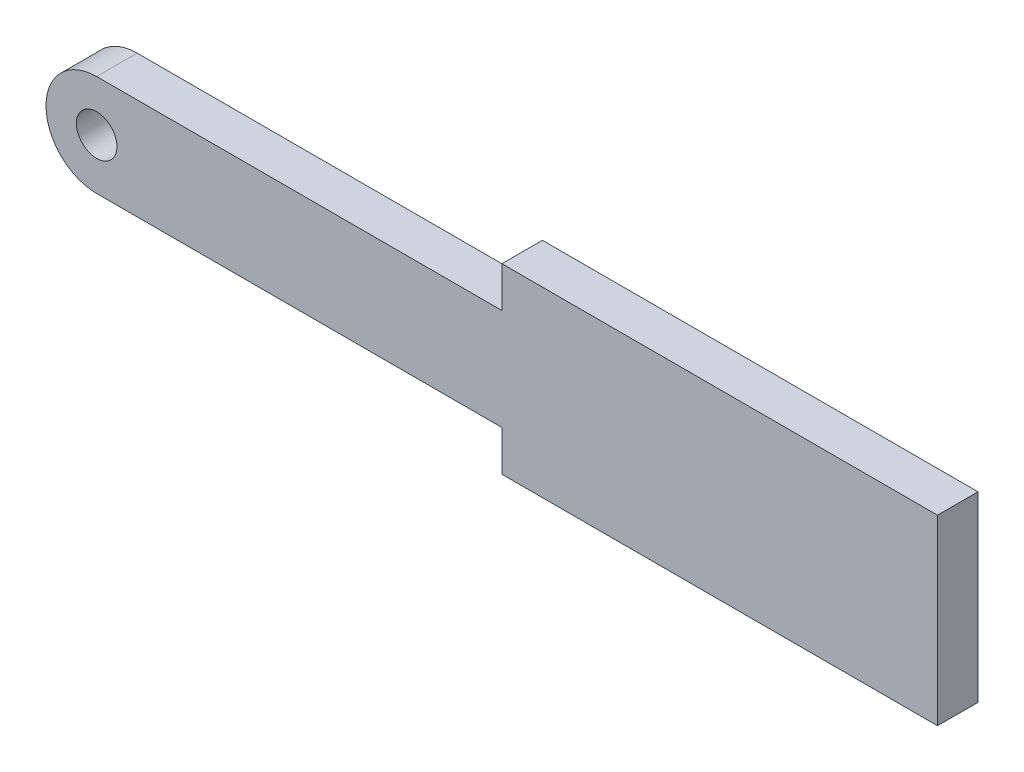
from build123d import *

# Parameters (mm, degrees)
SKETCH1_W           = 43
SKETCH1_H           = 18
BOSS_EXTRUDE1_DEPTH = 4
CAVITY2_DEPTH       = 2.3
BOSS_EXTRUDE2_DEPTH = 4


# Read off the part's stored shape, not the designer's step: Cavity2
with BuildPart() as part:
    # Sketch1 → Boss-Extrude1 (new body)
    with BuildSketch(Plane.XY):
        Rectangle(SKETCH1_W, SKETCH1_H)
    extrude(amount=BOSS_EXTRUDE1_DEPTH)

    # Cavity2 outline → Cavity2 (cut)
    with BuildSketch(Plane.XY):
        with BuildLine():
            ThreePointArc((-4.514897629, -4.536044466), (0, -6.4), (4.514897629, -4.536044466))
            Line((4.514897629, -4.536044466), (17, -2.7))
            ThreePointArc((17, -2.7), (19.7, 0), (17, 2.7))
            Line((17, 2.7), (4.514897629, 4.536044466))
            ThreePointArc((4.514897629, 4.536044466), (0, 6.4), (-4.514897629, 4.536044466))
            Line((-4.514897629, 4.536044466), (-17, 2.7))
            ThreePointArc((-17, 2.7), (-19.7, 0), (-17, -2.7))
            Line((-17, -2.7), (-4.514897629, -4.536044466))
        make_face()
    extrude(amount=CAVITY2_DEPTH, mode=Mode.SUBTRACT)

    # Sketch4 → Boss-Extrude2 (add)
    with BuildSketch(Plane.XY.offset(4)):
        with BuildLine():
            ThreePointArc((-56.5, 0), (-57.964466094, 3.535533906), (-61.5, 5))
            Line((-61.5, 5), (-61.5, 2))
            ThreePointArc((-61.5, 2), (-60.085786438, 1.414213562), (-59.5, 0))
            ThreePointArc((-59.5, 0), (-60.085786438, -1.414213562), (-61.5, -2))
            Line((-61.5, -2), (-61.5, -5))
            ThreePointArc((-61.5, -5), (-57.964466094, -3.535533906), (-56.5, 0))
        make_face()
        with BuildLine():
            Line((-61.5, 2), (-61.5, 5))
            ThreePointArc((-61.5, 5), (-66.5, 0), (-61.5, -5))
            Line((-61.5, -5), (-61.5, -2))
            ThreePointArc((-61.5, -2), (-63.5, 0), (-61.5, 2))
        make_face()
        with BuildLine():
            Line((-21.5, -5), (-21.5, 5))
            Line((-21.5, 5), (-61.5, 5))
            ThreePointArc((-61.5, 5), (-57.964466094, 3.535533906), (-56.5, 0))
            ThreePointArc((-56.5, 0), (-57.964466094, -3.535533906), (-61.5, -5))
            Line((-61.5, -5), (-21.5, -5))
        make_face()
    extrude(amount=-BOSS_EXTRUDE2_DEPTH)


solid = part.part
